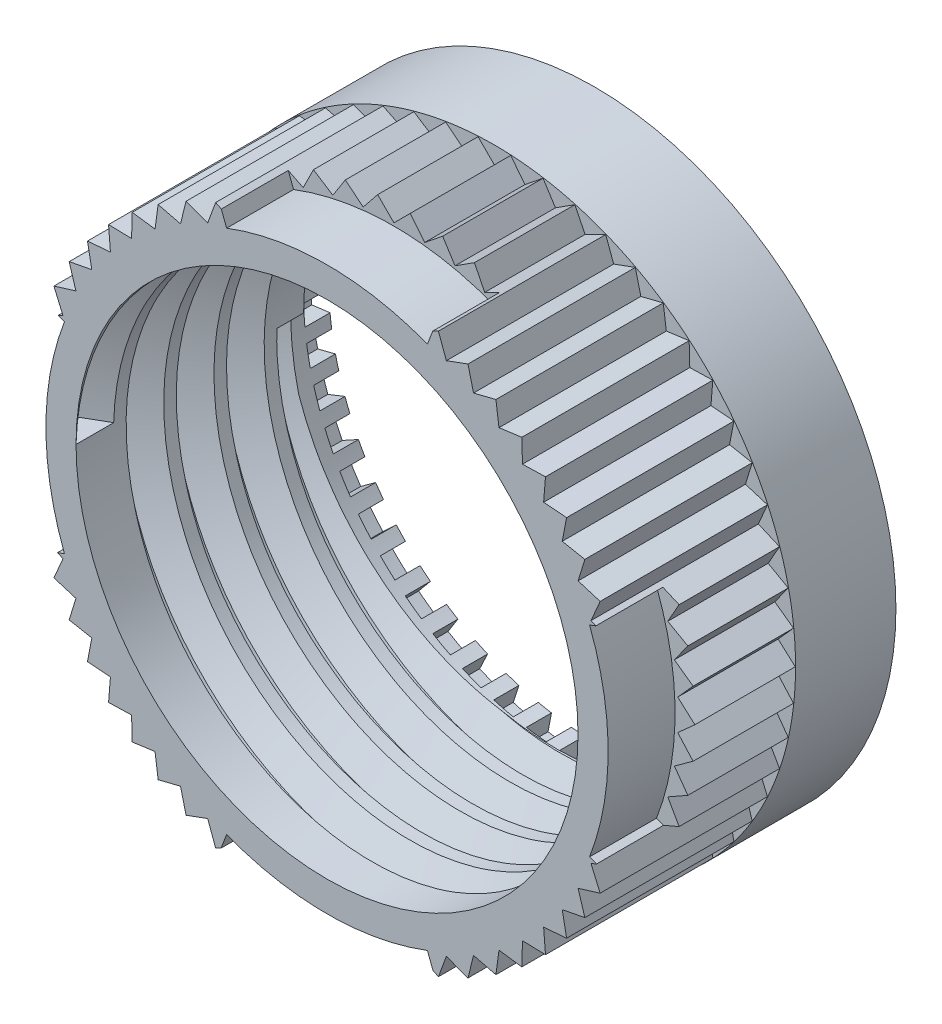
from build123d import *

# Parameters (mm, degrees)
SKETCH1_R           = 9
SKETCH1_R_2         = 7.5
BOSS_EXTRUDE1_DEPTH = 8
THREAD1_PITCH       = 1.5
CUT_EXTRUDE3_START  = -5
CUT_EXTRUDE3_DEPTH  = 5
CUT_EXTRUDE4_START  = -2
CUT_EXTRUDE4_DEPTH  = 2
SKETCH8_R           = 7.95
CUT_EXTRUDE5_DEPTH  = 1.2
CUT_EXTRUDE6_DEPTH  = 0.75


# Read off the part's stored shape, not the designer's step: Cut-Extrude3
with BuildPart() as part:
    # Sketch1 → Boss-Extrude1 (new body)
    with BuildSketch(Plane.XY):
        Circle(SKETCH1_R)
        Circle(SKETCH1_R_2, mode=Mode.SUBTRACT)
    extrude(amount=BOSS_EXTRUDE1_DEPTH)

    # Thread1: the profile of Thread Profile1 profile screwed along a right-hand helix of 4 turns, 8 arcs to a turn; built about Z, then put on its axis
    thread1_z = Axis((0, 0, 0), (0, 0, 1))
    thread1_corners = [(7.4997, 0, -0.000173205), (8.311898813, 0, 0.468749998), (8.311898813, 0, 0.656249998), (7.4997, 0, 1.125173201)]
    with BuildLine(mode=Mode.PRIVATE) as thread1_profile:
        Line(thread1_corners[0], thread1_corners[1])
        Line(thread1_corners[1], thread1_corners[2])
        Line(thread1_corners[2], thread1_corners[3])
        Line(thread1_corners[3], thread1_corners[0])
    thread1_cap = Face(thread1_profile.wire())
    thread1_turn_angles = [0, 22.5, 45, 67.5, 90, 112.5, 135, 157.5, 180, 202.5, 225, 247.5, 270, 292.5, 315, 337.5, 360]
    thread1_turn_weights = [1, 0.9238795325112867, 1, 0.9238795325112867, 1, 0.9238795325112867, 1, 0.9238795325112867, 1, 0.9238795325112867, 1, 0.9238795325112867, 1, 0.9238795325112867, 1, 0.9238795325112867, 1]
    thread1_turn_rails = [Edge.make_bspline([Vector(p[0], p[1], 0).rotate(thread1_z, thread1_turn_angles[k]) / thread1_turn_weights[k] + Vector(0, 0, p[2] + THREAD1_PITCH * thread1_turn_angles[k] / 360) for k in range(17)], [0, 0, 0, 1, 1, 2, 2, 3, 3, 4, 4, 5, 5, 6, 6, 7, 7, 8, 8, 8], 2, thread1_turn_weights) for p in thread1_corners]
    thread1_turn_sides = [Face.make_surface_from_curves(thread1_turn_rails[p[0]], thread1_turn_rails[p[1]]) for p in [(0, 1), (1, 2), (2, 3), (3, 0)]]
    thread1 = Plane(origin=(0, 0, 8), x_dir=(-1, 0, 0), z_dir=(0, 0, -1)) * Solid(Shell([*[p.moved(Location((0, 0, THREAD1_PITCH * i))) for i in range(4) for p in thread1_turn_sides], thread1_cap, thread1_cap.rotate(thread1_z, 1440).moved(Location((0, 0, THREAD1_PITCH * 1440 / 360)))]))
    add(thread1, mode=Mode.SUBTRACT)

    # Cut-Extrude3 outline → Cut-Extrude3 (cut)
    with BuildSketch(Plane.XY.offset(8).offset(CUT_EXTRUDE3_START)):
        with BuildLine():
            Line((3.32832854, -8.361361347), (2.711544799, -8.055464794))
            Line((2.711544799, -8.055464794), (2.405648246, -8.672248535))
            Line((2.405648246, -8.672248535), (1.825553353, -8.301459108))
            Line((1.825553353, -8.301459108), (1.454778838, -8.881645035))
            ThreePointArc((1.454778838, -8.881645035), (0, 9), (-1.454778838, -8.881645035))
            Line((-1.454778838, -8.881645035), (-1.825553353, -8.301459108))
            Line((-1.825553353, -8.301459108), (-2.405648246, -8.672248535))
            Line((-2.405648246, -8.672248535), (-2.711544799, -8.055464794))
            Line((-2.711544799, -8.055464794), (-3.32832854, -8.361361347))
            Line((-3.32832854, -8.361361347), (-3.565745861, -7.715119984))
            Line((-3.565745861, -7.715119984), (-4.211987224, -7.952537305))
            Line((-4.211987224, -7.952537305), (-4.378141813, -7.284414909))
            Line((-4.378141813, -7.284414909), (-5.046264209, -7.450569498))
            Line((-5.046264209, -7.450569498), (-5.139208055, -6.768399193))
            Line((-5.139208055, -6.768399193), (-5.82137836, -6.861343039))
            Line((-5.82137836, -6.861343039), (-5.840021782, -6.173122648))
            Line((-5.840021782, -6.173122648), (-6.528242173, -6.19176607))
            Line((-6.528242173, -6.19176607), (-6.472366593, -5.505564348))
            Line((-6.472366593, -5.505564348), (-7.158568314, -5.449688768))
            Line((-7.158568314, -5.449688768), (-7.028828823, -4.773550803))
            Line((-7.028828823, -4.773550803), (-7.704966788, -4.643811311))
            Line((-7.704966788, -4.643811311), (-7.502884462, -3.985664202))
            Line((-7.502884462, -3.985664202), (-8.16103157, -3.783581876))
            Line((-8.16103157, -3.783581876), (-7.88897564, -3.151141796))
            Line((-7.88897564, -3.151141796), (-8.52141572, -2.879085866))
            Line((-8.52141572, -2.879085866), (-8.182575792, -2.279767597))
            Line((-8.182575792, -2.279767597), (-8.781894061, -1.940927669))
            Line((-8.781894061, -1.940927669), (-8.380242724, -1.38175767))
            Line((-8.380242724, -1.38175767), (-8.939412723, -0.980106334))
            Line((-8.939412723, -0.980106334), (-8.479658973, -0.467640362))
            Line((-8.479658973, -0.467640362), (-8.992124945, -0.007886611))
            Line((-8.992124945, -0.007886611), (-8.479658973, 0.451867139))
            Line((-8.479658973, 0.451867139), (-8.939412723, 0.964333111))
            Line((-8.939412723, 0.964333111), (-8.380242724, 1.365984447))
            Line((-8.380242724, 1.365984447), (-8.781894061, 1.925154446))
            Line((-8.781894061, 1.925154446), (-8.182575792, 2.263994374))
            Line((-8.182575792, 2.263994374), (-8.52141572, 2.863312643))
            Line((-8.52141572, 2.863312643), (-7.88897564, 3.135368573))
            Line((-7.88897564, 3.135368573), (-8.16103157, 3.767808653))
            Line((-8.16103157, 3.767808653), (-7.502884462, 3.969890979))
            Line((-7.502884462, 3.969890979), (-7.704966788, 4.628038088))
            Line((-7.704966788, 4.628038088), (-7.028828823, 4.75777758))
            Line((-7.028828823, 4.75777758), (-7.158568314, 5.433915545))
            Line((-7.158568314, 5.433915545), (-6.472366593, 5.489791125))
            Line((-6.472366593, 5.489791125), (-6.528242173, 6.175992847))
            Line((-6.528242173, 6.175992847), (-5.840021782, 6.157349425))
            Line((-5.840021782, 6.157349425), (-5.82137836, 6.845569816))
            Line((-5.82137836, 6.845569816), (-5.139208055, 6.75262597))
            Line((-5.139208055, 6.75262597), (-5.046264209, 7.434796275))
            Line((-5.046264209, 7.434796275), (-4.378141813, 7.268641686))
            Line((-4.378141813, 7.268641686), (-4.211987224, 7.936764082))
            Line((-4.211987224, 7.936764082), (-3.565745861, 7.699346761))
            Line((-3.565745861, 7.699346761), (-3.32832854, 8.345588124))
            Line((-3.32832854, 8.345588124), (-2.711544799, 8.039691571))
            Line((-2.711544799, 8.039691571), (-2.405648246, 8.656475312))
            Line((-2.405648246, 8.656475312), (-1.825553353, 8.285685885))
            Line((-1.825553353, 8.285685885), (-1.454763927, 8.865780778))
            Line((-1.454763927, 8.865780778), (-0.918158964, 8.434445644))
            Line((-0.918158964, 8.434445644), (-0.48682383, 8.971050607))
            Line((-0.48682383, 8.971050607), (0, 8.484226777))
            Line((0, 8.484226777), (0.48682383, 8.971050607))
            Line((0.48682383, 8.971050607), (0.918158964, 8.434445644))
            Line((0.918158964, 8.434445644), (1.454763927, 8.865780778))
            Line((1.454763927, 8.865780778), (1.825553353, 8.285685885))
            Line((1.825553353, 8.285685885), (2.405648246, 8.656475312))
            Line((2.405648246, 8.656475312), (2.711544799, 8.039691571))
            Line((2.711544799, 8.039691571), (3.32832854, 8.345588124))
            Line((3.32832854, 8.345588124), (3.565745861, 7.699346761))
            Line((3.565745861, 7.699346761), (4.211987224, 7.936764082))
            Line((4.211987224, 7.936764082), (4.378141813, 7.268641686))
            Line((4.378141813, 7.268641686), (5.046264209, 7.434796275))
            Line((5.046264209, 7.434796275), (5.139208055, 6.75262597))
            Line((5.139208055, 6.75262597), (5.82137836, 6.845569816))
            Line((5.82137836, 6.845569816), (5.840021782, 6.157349425))
            Line((5.840021782, 6.157349425), (6.528242173, 6.175992847))
            Line((6.528242173, 6.175992847), (6.472366593, 5.489791125))
            Line((6.472366593, 5.489791125), (7.158568314, 5.433915545))
            Line((7.158568314, 5.433915545), (7.028828823, 4.75777758))
            Line((7.028828823, 4.75777758), (7.704966788, 4.628038088))
            Line((7.704966788, 4.628038088), (7.502884462, 3.969890979))
            Line((7.502884462, 3.969890979), (8.16103157, 3.767808653))
            Line((8.16103157, 3.767808653), (7.88897564, 3.135368573))
            Line((7.88897564, 3.135368573), (8.52141572, 2.863312643))
            Line((8.52141572, 2.863312643), (8.182575792, 2.263994374))
            Line((8.182575792, 2.263994374), (8.781894061, 1.925154446))
            Line((8.781894061, 1.925154446), (8.380242724, 1.365984447))
            Line((8.380242724, 1.365984447), (8.939412723, 0.964333111))
            Line((8.939412723, 0.964333111), (8.479658973, 0.451867139))
            Line((8.479658973, 0.451867139), (8.992124945, -0.007886611))
            Line((8.992124945, -0.007886611), (8.479658973, -0.467640362))
            Line((8.479658973, -0.467640362), (8.939412723, -0.980106334))
            Line((8.939412723, -0.980106334), (8.380242724, -1.38175767))
            Line((8.380242724, -1.38175767), (8.781894061, -1.940927669))
            Line((8.781894061, -1.940927669), (8.182575792, -2.279767597))
            Line((8.182575792, -2.279767597), (8.52141572, -2.879085866))
            Line((8.52141572, -2.879085866), (7.88897564, -3.151141796))
            Line((7.88897564, -3.151141796), (8.16103157, -3.783581876))
            Line((8.16103157, -3.783581876), (7.502884462, -3.985664202))
            Line((7.502884462, -3.985664202), (7.704966788, -4.643811311))
            Line((7.704966788, -4.643811311), (7.028828823, -4.773550803))
            Line((7.028828823, -4.773550803), (7.158568314, -5.449688768))
            Line((7.158568314, -5.449688768), (6.472366593, -5.505564348))
            Line((6.472366593, -5.505564348), (6.528242173, -6.19176607))
            Line((6.528242173, -6.19176607), (5.840021782, -6.173122648))
            Line((5.840021782, -6.173122648), (5.82137836, -6.861343039))
            Line((5.82137836, -6.861343039), (5.139208055, -6.768399193))
            Line((5.139208055, -6.768399193), (5.046264209, -7.450569498))
            Line((5.046264209, -7.450569498), (4.378141813, -7.284414909))
            Line((4.378141813, -7.284414909), (4.211987224, -7.952537305))
            Line((4.211987224, -7.952537305), (3.565745861, -7.715119984))
            Line((3.565745861, -7.715119984), (3.32832854, -8.361361347))
        make_face()
        with BuildLine():
            ThreePointArc((0.48682383, -8.98682383), (0.972224704, -8.947333632), (1.454778838, -8.881645035))
            Line((1.454778838, -8.881645035), (0.918158964, -8.450218867))
            Line((0.918158964, -8.450218867), (0.48682383, -8.98682383))
        make_face()
        with BuildLine():
            ThreePointArc((-0.48682383, -8.98682383), (0, -9), (0.48682383, -8.98682383))
            Line((0.48682383, -8.98682383), (0, -8.5))
            Line((0, -8.5), (-0.48682383, -8.98682383))
        make_face()
        with BuildLine():
            ThreePointArc((-1.454778838, -8.881645035), (-0.972224704, -8.947333632), (-0.48682383, -8.98682383))
            Line((-0.48682383, -8.98682383), (-0.918158964, -8.450218867))
            Line((-0.918158964, -8.450218867), (-1.454778838, -8.881645035))
        make_face()
    extrude(amount=CUT_EXTRUDE3_DEPTH, mode=Mode.SUBTRACT)

    # Sketch6 → Cut-Extrude4 (cut)
    with BuildSketch(Plane.XY.offset(8).offset(CUT_EXTRUDE4_START)):
        with BuildLine():
            Line((-8.406447963, 3.214285714), (-7.846018098, 3))
            ThreePointArc((-7.846018098, 3), (-8.4, 0), (-7.846018098, -3))
            Line((-7.846018098, -3), (-8.406447963, -3.214285714))
            ThreePointArc((-8.406447963, -3.214285714), (-9, 0), (-8.406447963, 3.214285714))
        make_face()
        with BuildLine():
            Line((3.214285714, 8.406447963), (3, 7.846018098))
            ThreePointArc((3, 7.846018098), (0, 8.4), (-3, 7.846018098))
            Line((-3, 7.846018098), (-3.214285714, 8.406447963))
            ThreePointArc((-3.214285714, 8.406447963), (0, 9), (3.214285714, 8.406447963))
        make_face()
        with BuildLine():
            Line((8.406447963, -3.214285714), (7.846018098, -3))
            ThreePointArc((7.846018098, -3), (8.4, 0), (7.846018098, 3))
            Line((7.846018098, 3), (8.406447963, 3.214285714))
            ThreePointArc((8.406447963, 3.214285714), (9, 0), (8.406447963, -3.214285714))
        make_face()
        with BuildLine():
            Line((-3.214285714, -8.406447963), (-3, -7.846018098))
            ThreePointArc((-3, -7.846018098), (0, -8.4), (3, -7.846018098))
            Line((3, -7.846018098), (3.214285714, -8.406447963))
            ThreePointArc((3.214285714, -8.406447963), (0, -9), (-3.214285714, -8.406447963))
        make_face()
    extrude(amount=CUT_EXTRUDE4_DEPTH, mode=Mode.SUBTRACT)

    # Sketch8 → Cut-Extrude5 (cut)
    with BuildSketch(Plane(origin=(0, 0, 0), x_dir=(-1, 0, 0), z_dir=(0, 0, -1))):
        Circle(SKETCH8_R)
    extrude(amount=-CUT_EXTRUDE5_DEPTH, mode=Mode.SUBTRACT)

    # Sketch9 → Cut-Extrude6 (cut)
    with BuildSketch(Plane(origin=(0, 0, 0), x_dir=(-1, 0, 0), z_dir=(0, 0, -1))):
        with BuildLine():
            Line((-7.947483879, -0.2), (-8.497646733, -0.2))
            ThreePointArc((-8.497646733, -0.2), (-8.483227192, -0.533719416), (-8.455706897, -0.866614602))
            Line((-8.455706897, -0.866614602), (-7.909882241, -0.797660913))
            ThreePointArc((-7.909882241, -0.797660913), (-7.934312491, -0.49918463), (-7.947483879, -0.2))
        make_face()
        with BuildLine():
            Line((-7.859748948, -1.194506793), (-8.405573604, -1.263460483))
            ThreePointArc((-8.405573604, -1.263460483), (-8.349441631, -1.592741174), (-8.280415512, -1.919562175))
            Line((-8.280415512, -1.919562175), (-7.747537036, -1.782742237))
            ThreePointArc((-7.747537036, -1.782742237), (-7.809183643, -1.489681451), (-7.859748948, -1.194506793))
        make_face()
        with BuildLine():
            ThreePointArc((-8.455706897, 0.866614602), (-8.483227192, 0.533719416), (-8.497646733, 0.2))
            Line((-8.497646733, 0.2), (-7.947483879, 0.2))
            ThreePointArc((-7.947483879, 0.2), (-7.934312491, 0.49918463), (-7.909882241, 0.797660913))
            Line((-7.909882241, 0.797660913), (-8.455706897, 0.866614602))
        make_face()
        with BuildLine():
            ThreePointArc((-8.280415512, 1.919562175), (-8.349441631, 1.592741174), (-8.405573604, 1.263460483))
            Line((-8.405573604, 1.263460483), (-7.859748948, 1.194506793))
            ThreePointArc((-7.859748948, 1.194506793), (-7.809183643, 1.489681451), (-7.747537036, 1.782742237))
            Line((-7.747537036, 1.782742237), (-8.280415512, 1.919562175))
        make_face()
        with BuildLine():
            ThreePointArc((-7.974537028, 2.942237105), (-8.083980389, 2.626644452), (-8.180939557, 2.306995439))
            Line((-8.180939557, 2.306995439), (-7.648061081, 2.170175501))
            ThreePointArc((-7.648061081, 2.170175501), (-7.560899305, 2.456685105), (-7.463008543, 2.739708651))
            Line((-7.463008543, 2.739708651), (-7.974537028, 2.942237105))
        make_face()
        with BuildLine():
            ThreePointArc((-7.542895332, 3.918511199), (-7.691029946, 3.619123978), (-7.827287207, 3.3141477))
            Line((-7.827287207, 3.3141477), (-7.315758722, 3.111619245))
            ThreePointArc((-7.315758722, 3.111619245), (-7.193375067, 3.384945368), (-7.060783947, 3.653468222))
            Line((-7.060783947, 3.653468222), (-7.542895332, 3.918511199))
        make_face()
        with BuildLine():
            ThreePointArc((-6.99229767, 4.83298803), (-7.176787367, 4.554527757), (-7.350193862, 4.269033871))
            Line((-7.350193862, 4.269033871), (-6.868082478, 4.003990894))
            ThreePointArc((-6.868082478, 4.003990894), (-6.712407008, 4.25982302), (-6.547206571, 4.509610418))
            Line((-6.547206571, 4.509610418), (-6.99229767, 4.83298803))
        make_face()
        with BuildLine():
            ThreePointArc((-6.331427297, 5.671245753), (-6.549362564, 5.418103913), (-6.757183569, 5.156594828))
            Line((-6.757183569, 5.156594828), (-6.31209247, 4.833217216))
            ThreePointArc((-6.31209247, 4.833217216), (-6.12558028, 5.067520719), (-5.930375836, 5.294633363))
            Line((-5.930375836, 5.294633363), (-6.331427297, 5.671245753))
        make_face()
        with BuildLine():
            ThreePointArc((-5.570706533, 6.420064542), (-5.8186504, 6.196233333), (-6.057608454, 5.962833204))
            Line((-6.057608454, 5.962833204), (-5.656556993, 5.586220814))
            ThreePointArc((-5.656556993, 5.586220814), (-5.442149492, 5.795300588), (-5.220019531, 5.996156777))
            Line((-5.220019531, 5.996156777), (-5.570706533, 6.420064542))
        make_face()
        with BuildLine():
            ThreePointArc((-4.722132399, 7.067635079), (-4.996174644, 6.876644452), (-5.262501236, 6.675034138))
            Line((-5.262501236, 6.675034138), (-4.911814234, 6.251126373))
            ThreePointArc((-4.911814234, 6.251126373), (-4.672892756, 6.431685105), (-4.4273404, 6.603117217))
            Line((-4.4273404, 6.603117217), (-4.722132399, 7.067635079))
        make_face()
        with BuildLine():
            ThreePointArc((-3.799087416, 7.603744788), (-4.09490623, 7.44860678), (-4.384401229, 7.281965797))
            Line((-4.384401229, 7.281965797), (-4.08960923, 6.817447935))
            ThreePointArc((-4.08960923, 6.817447935), (-3.829941709, 6.966638106), (-3.564839466, 7.105942554))
            Line((-3.564839466, 7.105942554), (-3.799087416, 7.603744788))
        make_face()
        with BuildLine():
            ThreePointArc((-2.816128556, 8.0199389), (-3.129058698, 7.90310013), (-3.437156595, 7.774056505))
            Line((-3.437156595, 7.774056505), (-3.202908645, 7.276254271))
            ThreePointArc((-3.202908645, 7.276254271), (-2.926590194, 7.391723063), (-2.646118884, 7.496702932))
            Line((-2.646118884, 7.496702932), (-2.816128556, 8.0199389))
        make_face()
        with BuildLine():
            ThreePointArc((-1.788757666, 8.309653784), (-2.113864041, 8.23295687), (-2.435705949, 8.143545698))
            Line((-2.435705949, 8.143545698), (-2.265696278, 7.62030973))
            ThreePointArc((-2.265696278, 7.62030973), (-1.977084603, 7.700236131), (-1.685667427, 7.769235826))
            Line((-1.685667427, 7.769235826), (-1.788757666, 8.309653784))
        make_face()
        with BuildLine():
            ThreePointArc((-0.733176999, 8.468320464), (-1.065332485, 8.432974961), (-1.395842766, 8.38460631))
            Line((-1.395842766, 8.38460631), (-1.292752527, 7.844188352))
            ThreePointArc((-1.292752527, 7.844188352), (-0.996399207, 7.887311875), (-0.698631987, 7.919243231))
            Line((-0.698631987, 7.919243231), (-0.733176999, 8.468320464))
        make_face()
        with BuildLine():
            ThreePointArc((0.333966307, 8.493436672), (0, 8.5), (-0.333966307, 8.493436672))
            Line((-0.333966307, 8.493436672), (-0.299421296, 7.944359438))
            ThreePointArc((-0.299421296, 7.944359438), (0, 7.95), (0.299421296, 7.944359438))
            Line((0.299421296, 7.944359438), (0.333966307, 8.493436672))
        make_face()
        with BuildLine():
            ThreePointArc((1.395842766, 8.38460631), (1.065332485, 8.432974961), (0.733176999, 8.468320464))
            Line((0.733176999, 8.468320464), (0.698631987, 7.919243231))
            ThreePointArc((0.698631987, 7.919243231), (0.996399207, 7.887311875), (1.292752527, 7.844188352))
            Line((1.292752527, 7.844188352), (1.395842766, 8.38460631))
        make_face()
        with BuildLine():
            ThreePointArc((2.435705949, 8.143545698), (2.113864041, 8.23295687), (1.788757666, 8.309653784))
            Line((1.788757666, 8.309653784), (1.685667427, 7.769235826))
            ThreePointArc((1.685667427, 7.769235826), (1.977084603, 7.700236131), (2.265696278, 7.62030973))
            Line((2.265696278, 7.62030973), (2.435705949, 8.143545698))
        make_face()
        with BuildLine():
            ThreePointArc((3.437156595, 7.774056505), (3.129058698, 7.90310013), (2.816128556, 8.0199389))
            Line((2.816128556, 8.0199389), (2.646118884, 7.496702932))
            ThreePointArc((2.646118884, 7.496702932), (2.926590194, 7.391723063), (3.202908645, 7.276254271))
            Line((3.202908645, 7.276254271), (3.437156595, 7.774056505))
        make_face()
        with BuildLine():
            ThreePointArc((4.384401229, 7.281965797), (4.09490623, 7.44860678), (3.799087416, 7.603744788))
            Line((3.799087416, 7.603744788), (3.564839466, 7.105942554))
            ThreePointArc((3.564839466, 7.105942554), (3.829941709, 6.966638106), (4.08960923, 6.817447935))
            Line((4.08960923, 6.817447935), (4.384401229, 7.281965797))
        make_face()
        with BuildLine():
            ThreePointArc((5.262501236, 6.675034138), (4.996174644, 6.876644452), (4.722132399, 7.067635079))
            Line((4.722132399, 7.067635079), (4.4273404, 6.603117217))
            ThreePointArc((4.4273404, 6.603117217), (4.672892756, 6.431685105), (4.911814234, 6.251126373))
            Line((4.911814234, 6.251126373), (5.262501236, 6.675034138))
        make_face()
        with BuildLine():
            ThreePointArc((6.057608454, 5.962833204), (5.8186504, 6.196233333), (5.570706533, 6.420064542))
            Line((5.570706533, 6.420064542), (5.220019531, 5.996156777))
            ThreePointArc((5.220019531, 5.996156777), (5.442149492, 5.795300588), (5.656556993, 5.586220814))
            Line((5.656556993, 5.586220814), (6.057608454, 5.962833204))
        make_face()
        with BuildLine():
            ThreePointArc((6.757183569, 5.156594828), (6.549362564, 5.418103913), (6.331427297, 5.671245753))
            Line((6.331427297, 5.671245753), (5.930375836, 5.294633363))
            ThreePointArc((5.930375836, 5.294633363), (6.12558028, 5.067520719), (6.31209247, 4.833217216))
            Line((6.31209247, 4.833217216), (6.757183569, 5.156594828))
        make_face()
        with BuildLine():
            ThreePointArc((7.350193862, 4.269033871), (7.176787367, 4.554527757), (6.99229767, 4.83298803))
            Line((6.99229767, 4.83298803), (6.547206571, 4.509610418))
            ThreePointArc((6.547206571, 4.509610418), (6.712407008, 4.25982302), (6.868082478, 4.003990894))
            Line((6.868082478, 4.003990894), (7.350193862, 4.269033871))
        make_face()
        with BuildLine():
            ThreePointArc((7.827287207, 3.3141477), (7.691029946, 3.619123978), (7.542895332, 3.918511199))
            Line((7.542895332, 3.918511199), (7.060783947, 3.653468222))
            ThreePointArc((7.060783947, 3.653468222), (7.193375067, 3.384945368), (7.315758722, 3.111619245))
            Line((7.315758722, 3.111619245), (7.827287207, 3.3141477))
        make_face()
        with BuildLine():
            ThreePointArc((8.180939557, 2.306995439), (8.083980389, 2.626644452), (7.974537028, 2.942237105))
            Line((7.974537028, 2.942237105), (7.463008543, 2.739708651))
            ThreePointArc((7.463008543, 2.739708651), (7.560899305, 2.456685105), (7.648061081, 2.170175501))
            Line((7.648061081, 2.170175501), (8.180939557, 2.306995439))
        make_face()
        with BuildLine():
            ThreePointArc((8.405573604, 1.263460483), (8.349441631, 1.592741174), (8.280415512, 1.919562175))
            Line((8.280415512, 1.919562175), (7.747537036, 1.782742237))
            ThreePointArc((7.747537036, 1.782742237), (7.809183643, 1.489681451), (7.859748948, 1.194506793))
            Line((7.859748948, 1.194506793), (8.405573604, 1.263460483))
        make_face()
        with BuildLine():
            ThreePointArc((8.497646733, 0.2), (8.483227192, 0.533719416), (8.455706897, 0.866614602))
            Line((8.455706897, 0.866614602), (7.909882241, 0.797660913))
            ThreePointArc((7.909882241, 0.797660913), (7.934312491, 0.49918463), (7.947483879, 0.2))
            Line((7.947483879, 0.2), (8.497646733, 0.2))
        make_face()
        with BuildLine():
            Line((7.909882241, -0.797660913), (8.455706897, -0.866614602))
            ThreePointArc((8.455706897, -0.866614602), (8.483227192, -0.533719416), (8.497646733, -0.2))
            Line((8.497646733, -0.2), (7.947483879, -0.2))
            ThreePointArc((7.947483879, -0.2), (7.934312491, -0.49918463), (7.909882241, -0.797660913))
        make_face()
        with BuildLine():
            Line((7.747537036, -1.782742237), (8.280415512, -1.919562175))
            ThreePointArc((8.280415512, -1.919562175), (8.349441631, -1.592741174), (8.405573604, -1.263460483))
            Line((8.405573604, -1.263460483), (7.859748948, -1.194506793))
            ThreePointArc((7.859748948, -1.194506793), (7.809183643, -1.489681451), (7.747537036, -1.782742237))
        make_face()
        with BuildLine():
            Line((7.463008543, -2.739708651), (7.974537028, -2.942237105))
            ThreePointArc((7.974537028, -2.942237105), (8.083980389, -2.626644452), (8.180939557, -2.306995439))
            Line((8.180939557, -2.306995439), (7.648061081, -2.170175501))
            ThreePointArc((7.648061081, -2.170175501), (7.560899305, -2.456685105), (7.463008543, -2.739708651))
        make_face()
        with BuildLine():
            Line((7.060783947, -3.653468222), (7.542895332, -3.918511199))
            ThreePointArc((7.542895332, -3.918511199), (7.691029946, -3.619123978), (7.827287207, -3.3141477))
            Line((7.827287207, -3.3141477), (7.315758722, -3.111619245))
            ThreePointArc((7.315758722, -3.111619245), (7.193375067, -3.384945368), (7.060783947, -3.653468222))
        make_face()
        with BuildLine():
            Line((6.547206571, -4.509610418), (6.99229767, -4.83298803))
            ThreePointArc((6.99229767, -4.83298803), (7.176787367, -4.554527757), (7.350193862, -4.269033871))
            Line((7.350193862, -4.269033871), (6.868082478, -4.003990894))
            ThreePointArc((6.868082478, -4.003990894), (6.712407008, -4.25982302), (6.547206571, -4.509610418))
        make_face()
        with BuildLine():
            Line((5.930375836, -5.294633363), (6.331427297, -5.671245753))
            ThreePointArc((6.331427297, -5.671245753), (6.549362564, -5.418103913), (6.757183569, -5.156594828))
            Line((6.757183569, -5.156594828), (6.31209247, -4.833217216))
            ThreePointArc((6.31209247, -4.833217216), (6.12558028, -5.067520719), (5.930375836, -5.294633363))
        make_face()
        with BuildLine():
            Line((5.220019531, -5.996156777), (5.570706533, -6.420064542))
            ThreePointArc((5.570706533, -6.420064542), (5.8186504, -6.196233333), (6.057608454, -5.962833204))
            Line((6.057608454, -5.962833204), (5.656556993, -5.586220814))
            ThreePointArc((5.656556993, -5.586220814), (5.442149492, -5.795300588), (5.220019531, -5.996156777))
        make_face()
        with BuildLine():
            Line((4.4273404, -6.603117217), (4.722132399, -7.067635079))
            ThreePointArc((4.722132399, -7.067635079), (4.996174644, -6.876644452), (5.262501236, -6.675034138))
            Line((5.262501236, -6.675034138), (4.911814234, -6.251126373))
            ThreePointArc((4.911814234, -6.251126373), (4.672892756, -6.431685105), (4.4273404, -6.603117217))
        make_face()
        with BuildLine():
            Line((3.564839466, -7.105942554), (3.799087416, -7.603744788))
            ThreePointArc((3.799087416, -7.603744788), (4.09490623, -7.44860678), (4.384401229, -7.281965797))
            Line((4.384401229, -7.281965797), (4.08960923, -6.817447935))
            ThreePointArc((4.08960923, -6.817447935), (3.829941709, -6.966638106), (3.564839466, -7.105942554))
        make_face()
        with BuildLine():
            Line((2.646118884, -7.496702932), (2.816128556, -8.0199389))
            ThreePointArc((2.816128556, -8.0199389), (3.129058698, -7.90310013), (3.437156595, -7.774056505))
            Line((3.437156595, -7.774056505), (3.202908645, -7.276254271))
            ThreePointArc((3.202908645, -7.276254271), (2.926590194, -7.391723063), (2.646118884, -7.496702932))
        make_face()
        with BuildLine():
            Line((1.685667427, -7.769235826), (1.788757666, -8.309653784))
            ThreePointArc((1.788757666, -8.309653784), (2.113864041, -8.23295687), (2.435705949, -8.143545698))
            Line((2.435705949, -8.143545698), (2.265696278, -7.62030973))
            ThreePointArc((2.265696278, -7.62030973), (1.977084603, -7.700236131), (1.685667427, -7.769235826))
        make_face()
        with BuildLine():
            Line((0.698631987, -7.919243231), (0.733176999, -8.468320464))
            ThreePointArc((0.733176999, -8.468320464), (1.065332485, -8.432974961), (1.395842766, -8.38460631))
            Line((1.395842766, -8.38460631), (1.292752527, -7.844188352))
            ThreePointArc((1.292752527, -7.844188352), (0.996399207, -7.887311875), (0.698631987, -7.919243231))
        make_face()
        with BuildLine():
            Line((-0.299421296, -7.944359438), (-0.333966307, -8.493436672))
            ThreePointArc((-0.333966307, -8.493436672), (0, -8.5), (0.333966307, -8.493436672))
            Line((0.333966307, -8.493436672), (0.299421296, -7.944359438))
            ThreePointArc((0.299421296, -7.944359438), (0, -7.95), (-0.299421296, -7.944359438))
        make_face()
        with BuildLine():
            Line((-1.292752527, -7.844188352), (-1.395842766, -8.38460631))
            ThreePointArc((-1.395842766, -8.38460631), (-1.065332485, -8.432974961), (-0.733176999, -8.468320464))
            Line((-0.733176999, -8.468320464), (-0.698631987, -7.919243231))
            ThreePointArc((-0.698631987, -7.919243231), (-0.996399207, -7.887311875), (-1.292752527, -7.844188352))
        make_face()
        with BuildLine():
            Line((-2.265696278, -7.62030973), (-2.435705949, -8.143545698))
            ThreePointArc((-2.435705949, -8.143545698), (-2.113864041, -8.23295687), (-1.788757666, -8.309653784))
            Line((-1.788757666, -8.309653784), (-1.685667427, -7.769235826))
            ThreePointArc((-1.685667427, -7.769235826), (-1.977084603, -7.700236131), (-2.265696278, -7.62030973))
        make_face()
        with BuildLine():
            Line((-3.202908645, -7.276254271), (-3.437156595, -7.774056505))
            ThreePointArc((-3.437156595, -7.774056505), (-3.129058698, -7.90310013), (-2.816128556, -8.0199389))
            Line((-2.816128556, -8.0199389), (-2.646118884, -7.496702932))
            ThreePointArc((-2.646118884, -7.496702932), (-2.926590194, -7.391723063), (-3.202908645, -7.276254271))
        make_face()
        with BuildLine():
            Line((-4.08960923, -6.817447935), (-4.384401229, -7.281965797))
            ThreePointArc((-4.384401229, -7.281965797), (-4.09490623, -7.44860678), (-3.799087416, -7.603744788))
            Line((-3.799087416, -7.603744788), (-3.564839466, -7.105942554))
            ThreePointArc((-3.564839466, -7.105942554), (-3.829941709, -6.966638106), (-4.08960923, -6.817447935))
        make_face()
        with BuildLine():
            Line((-4.911814234, -6.251126373), (-5.262501236, -6.675034138))
            ThreePointArc((-5.262501236, -6.675034138), (-4.996174644, -6.876644452), (-4.722132399, -7.067635079))
            Line((-4.722132399, -7.067635079), (-4.4273404, -6.603117217))
            ThreePointArc((-4.4273404, -6.603117217), (-4.672892756, -6.431685105), (-4.911814234, -6.251126373))
        make_face()
        with BuildLine():
            Line((-5.656556993, -5.586220814), (-6.057608454, -5.962833204))
            ThreePointArc((-6.057608454, -5.962833204), (-5.8186504, -6.196233333), (-5.570706533, -6.420064542))
            Line((-5.570706533, -6.420064542), (-5.220019531, -5.996156777))
            ThreePointArc((-5.220019531, -5.996156777), (-5.442149492, -5.795300588), (-5.656556993, -5.586220814))
        make_face()
        with BuildLine():
            Line((-6.31209247, -4.833217216), (-6.757183569, -5.156594828))
            ThreePointArc((-6.757183569, -5.156594828), (-6.549362564, -5.418103913), (-6.331427297, -5.671245753))
            Line((-6.331427297, -5.671245753), (-5.930375836, -5.294633363))
            ThreePointArc((-5.930375836, -5.294633363), (-6.12558028, -5.067520719), (-6.31209247, -4.833217216))
        make_face()
        with BuildLine():
            Line((-6.868082478, -4.003990894), (-7.350193862, -4.269033871))
            ThreePointArc((-7.350193862, -4.269033871), (-7.176787367, -4.554527757), (-6.99229767, -4.83298803))
            Line((-6.99229767, -4.83298803), (-6.547206571, -4.509610418))
            ThreePointArc((-6.547206571, -4.509610418), (-6.712407008, -4.25982302), (-6.868082478, -4.003990894))
        make_face()
        with BuildLine():
            Line((-7.315758722, -3.111619245), (-7.827287207, -3.3141477))
            ThreePointArc((-7.827287207, -3.3141477), (-7.691029946, -3.619123978), (-7.542895332, -3.918511199))
            Line((-7.542895332, -3.918511199), (-7.060783947, -3.653468222))
            ThreePointArc((-7.060783947, -3.653468222), (-7.193375067, -3.384945368), (-7.315758722, -3.111619245))
        make_face()
        with BuildLine():
            Line((-7.648061081, -2.170175501), (-8.180939557, -2.306995439))
            ThreePointArc((-8.180939557, -2.306995439), (-8.083980389, -2.626644452), (-7.974537028, -2.942237105))
            Line((-7.974537028, -2.942237105), (-7.463008543, -2.739708651))
            ThreePointArc((-7.463008543, -2.739708651), (-7.560899305, -2.456685105), (-7.648061081, -2.170175501))
        make_face()
    extrude(amount=-CUT_EXTRUDE6_DEPTH, mode=Mode.SUBTRACT)


solid = part.part
